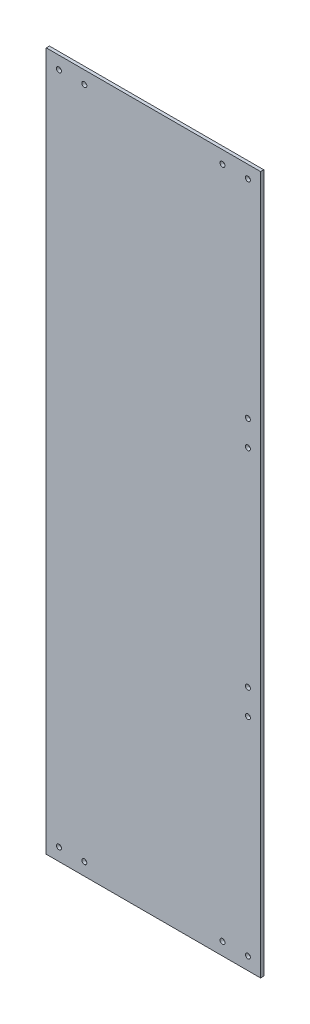
from build123d import *

# Parameters (mm, degrees)
SKETCH1_W                  = 698.5
SKETCH1_H                  = 214.376
BOSS_EXTRUDE1_DEPTH        = 3.175
F_9_0_196_DIAMETER_HOLE2_D = 4.9784


with BuildPart() as part:
    # Sketch1 → Boss-Extrude1 (new body)
    with BuildSketch(Plane(origin=(0, 0, 0), x_dir=(0, 1, 0), z_dir=(0, 0, 1))):
        Rectangle(SKETCH1_W, SKETCH1_H)
    extrude(amount=BOSS_EXTRUDE1_DEPTH)

    # #9 (0.196) Diameter Hole2 (through all)
    with Locations(Plane.XY.offset(3.175)):
        with Locations((-94.488, 336.55), (-69.088, 336.55), (69.088, 336.55), (94.488, 336.55), (94.488, -336.55), (69.088, -336.55), (-69.088, -336.55), (-94.488, -336.55), (-371.836153613, -199.719855434), (94.488, 129.116666667), (94.488, 103.716666667), (94.488, -103.716666667), (94.488, -129.116666667)):
            Hole(F_9_0_196_DIAMETER_HOLE2_D / 2)


solid = part.part
